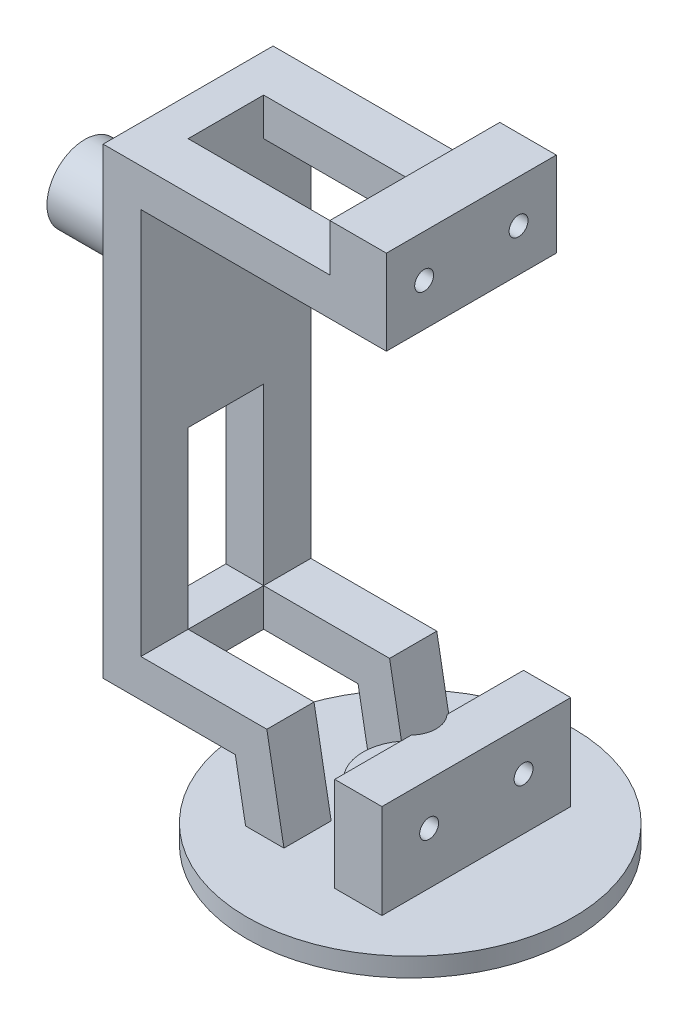
from build123d import *

# Parameters (mm, degrees)
SKETCH1_W                  = 40
SKETCH1_H                  = 25
BOSS_EXTRUDE1_DEPTH        = 2
SKETCH2_W                  = 5
SKETCH2_H                  = 20
BOSS_EXTRUDE2_DEPTH        = 10
SKETCH4_W                  = 19.965035534
SKETCH4_H                  = 6
BOSS_EXTRUDE3_DEPTH        = 5
SKETCH5_R                  = 1
CUT_EXTRUDE2_DEPTH         = 5
SKETCH6_W                  = 4
SKETCH6_H                  = 5
BOSS_EXTRUDE4_DEPTH        = 10
SKETCH8_W                  = 5
SKETCH8_H                  = 4
BOSS_EXTRUDE5_DEPTH        = 10
SKETCH9_W                  = 4
SKETCH9_H                  = 5
BOSS_EXTRUDE6_DEPTH        = 45
SKETCH12_W                 = 18
SKETCH12_H                 = 4
BOSS_EXTRUDE8_DEPTH        = 4
SKETCH13_W                 = 5
SKETCH13_H                 = 4
BOSS_EXTRUDE9_DEPTH        = 26
SKETCH14_W                 = 18
SKETCH14_H                 = 4
BOSS_EXTRUDE10_DEPTH       = 6
SKETCH16_W                 = 5.988277512
SKETCH16_H                 = 18
BOSS_EXTRUDE11_DEPTH       = 5
SKETCH15_R                 = 1
CUT_EXTRUDE3_DEPTH         = 6
SKETCH17_R                 = 3
CUT_EXTRUDE5_DEPTH         = 6
SKETCH24_W                 = 8
SKETCH24_H                 = 18.5
BOSS_EXTRUDE18_DEPTH       = 4
BOSS_EXTRUDE20_START       = -1
SKETCH20_R                 = 5
SKETCH20_R_2               = 3
BOSS_EXTRUDE20_DEPTH       = 1
BOSS_EXTRUDE21_OUTLINE_R   = 2.998308623
BOSS_EXTRUDE21_OUTLINE_R_2 = 1.5
BOSS_EXTRUDE21_DEPTH       = 1
SKETCH27_R                 = 5
SKETCH27_R_2               = 2.75
BOSS_EXTRUDE22_DEPTH       = 2
SKETCH28_R                 = 2.75
CUT_EXTRUDE10_DEPTH        = 10
SKETCH31_R                 = 4
BOSS_EXTRUDE23_DEPTH       = 11
SKETCH32_R                 = 23.58495283
BOSS_EXTRUDE24_DEPTH       = 2
SKETCH33_R                 = 3
CUT_EXTRUDE11_DEPTH        = 3
CUT_EXTRUDE12_DEPTH        = 10
CUT_EXTRUDE13_DEPTH        = 4
BOSS_EXTRUDE25_DEPTH       = 2
CUT_EXTRUDE15_DEPTH        = 2
SKETCH38_W                 = 4
SKETCH38_H                 = 6
CUT_EXTRUDE16_DEPTH        = 76.679363321
BOSS_EXTRUDE26_DEPTH       = 5


# Read off the part's stored shape, not the designer's step: Boss-Extrude21
with BuildPart() as part:
    # Sketch1 → Boss-Extrude1 (new body)
    with BuildSketch(Plane(origin=(0, 0, 0), x_dir=(1, 0, 0), z_dir=(0, 1, 0))):
        Rectangle(SKETCH1_W, SKETCH1_H)
    extrude(amount=BOSS_EXTRUDE1_DEPTH)

    # Sketch2 → Boss-Extrude2 (add)
    with BuildSketch(Plane(origin=(0, 2, 0), x_dir=(1, 0, 0), z_dir=(0, 1, 0))):
        with Locations((4.5, 0)):
            Rectangle(SKETCH2_W, SKETCH2_H)
    extrude(amount=BOSS_EXTRUDE2_DEPTH)

    # Sketch4 → Boss-Extrude3 (add)
    with BuildSketch(Plane(origin=(7, 0, 0), x_dir=(0, 0, -1), z_dir=(1, 0, 0))):
        with Locations((-0.017482233, 9)):
            Rectangle(SKETCH4_W, SKETCH4_H)
    extrude(amount=-BOSS_EXTRUDE3_DEPTH)

    # Sketch5 → Cut-Extrude2 (cut)
    with BuildSketch(Plane(origin=(7, 0, 0), x_dir=(0, 0, -1), z_dir=(1, 0, 0))):
        with Locations((5, 7.5)):
            Circle(SKETCH5_R)
        with Locations((-5, 7.5)):
            Circle(SKETCH5_R)
    extrude(amount=-CUT_EXTRUDE2_DEPTH, mode=Mode.SUBTRACT)

    # Sketch6 → Boss-Extrude4 (add)
    with BuildSketch(Plane(origin=(0, 2, 0), x_dir=(1, 0, 0), z_dir=(0, 1, 0))):
        with Locations((-11.527661753, -6.5)):
            Rectangle(SKETCH6_W, SKETCH6_H)
        with Locations((-11.527661753, 6.5)):
            Rectangle(SKETCH6_W, SKETCH6_H)
    extrude(amount=BOSS_EXTRUDE4_DEPTH)

    # Sketch8 → Boss-Extrude5 (add)
    with BuildSketch(Plane.ZY.offset(13.527661753)):
        with Locations((-6.5, 10)):
            Rectangle(SKETCH8_W, SKETCH8_H)
    boss_extrude5 = extrude(amount=BOSS_EXTRUDE5_DEPTH)

    # Mirror1: Boss-Extrude5 across plane
    add(boss_extrude5.mirror(Plane(origin=(0, 0, 0), x_dir=(1, 0, 0), z_dir=(0, 0, -1))))

    # Sketch9 → Boss-Extrude6 (add)
    with BuildSketch(Plane(origin=(0, 12, 0), x_dir=(1, 0, 0), z_dir=(0, 1, 0))):
        with Locations((-21.527661753, 6.5)):
            Rectangle(SKETCH9_W, SKETCH9_H)
    boss_extrude6 = extrude(amount=BOSS_EXTRUDE6_DEPTH)

    # Mirror2: Boss-Extrude5 across plane
    add(boss_extrude5.mirror(Plane(origin=(0, 0, 0), x_dir=(1, 0, 0), z_dir=(0, 0, -1))))

    # Mirror3: Boss-Extrude6 across plane
    add(boss_extrude6.mirror(Plane(origin=(0, 0, 0), x_dir=(1, 0, 0), z_dir=(0, 0, -1))))

    # Sketch12 → Boss-Extrude8 (add)
    with BuildSketch(Plane.ZY.offset(23.527661753)):
        with Locations((0, 55)):
            Rectangle(SKETCH12_W, SKETCH12_H)
        with Locations((0, 10)):
            Rectangle(SKETCH12_W, SKETCH12_H)
        with Locations((0, 32.5)):
            Rectangle(SKETCH12_W, SKETCH12_H)
    extrude(amount=-BOSS_EXTRUDE8_DEPTH)

    # Sketch13 → Boss-Extrude9 (add)
    with BuildSketch(Plane(origin=(-19.527661753, 0, 0), x_dir=(0, 0, -1), z_dir=(1, 0, 0))):
        with Locations((-6.5, 55)):
            Rectangle(SKETCH13_W, SKETCH13_H)
        with Locations((6.5, 55)):
            Rectangle(SKETCH13_W, SKETCH13_H)
    extrude(amount=BOSS_EXTRUDE9_DEPTH)

    # Sketch14 → Boss-Extrude10 (add)
    with BuildSketch(Plane(origin=(6.472338247, 0, 0), x_dir=(0, 0, -1), z_dir=(1, 0, 0))):
        with Locations((0, 55)):
            Rectangle(SKETCH14_W, SKETCH14_H)
    extrude(amount=-BOSS_EXTRUDE10_DEPTH)

    # Sketch16 → Boss-Extrude11 (add)
    with BuildSketch(Plane(origin=(0, 57, 0), x_dir=(1, 0, 0), z_dir=(0, 1, 0))):
        with Locations((3.478199491, 0)):
            Rectangle(SKETCH16_W, SKETCH16_H)
    extrude(amount=BOSS_EXTRUDE11_DEPTH)

    # Sketch15 → Cut-Extrude3 (cut)
    with BuildSketch(Plane(origin=(6.472338247, 0, 0), x_dir=(0, 0, -1), z_dir=(1, 0, 0))):
        with Locations((-5, 57.5)):
            Circle(SKETCH15_R)
        with Locations((5, 57.5)):
            Circle(SKETCH15_R)
    extrude(amount=-CUT_EXTRUDE3_DEPTH, mode=Mode.SUBTRACT)

    # Sketch17 → Cut-Extrude5 (cut)
    with BuildSketch(Plane.XZ):
        with Locations(Location((0, 0, 0), (0, 0, 270))):
            Circle(SKETCH17_R)
    extrude(amount=-CUT_EXTRUDE5_DEPTH, mode=Mode.SUBTRACT)

    # Sketch24 → Boss-Extrude18 (add)
    with BuildSketch(Plane.ZY.offset(23.527661753)):
        with Locations((0, 43.75)):
            Rectangle(SKETCH24_W, SKETCH24_H)
    extrude(amount=-BOSS_EXTRUDE18_DEPTH)

    # Sketch20 → Boss-Extrude20 (add)
    with BuildSketch(Plane(origin=(0, 3, 0), x_dir=(1, 0, 0), z_dir=(0, 1, 0)).offset(BOSS_EXTRUDE20_START)):
        Circle(SKETCH20_R)
        with Locations(Location((0, 0, 0), (0, 0, 90))):
            Circle(SKETCH20_R_2, mode=Mode.SUBTRACT)
    extrude(amount=BOSS_EXTRUDE20_DEPTH)

    # Boss-Extrude21 outline → Boss-Extrude21 (add)
    # profile 1 of 2: a face of its own
    with BuildSketch(Plane(origin=(0, 3, 0), x_dir=(1, 0, 0), z_dir=(0, 1, 0))):
        with BuildLine():
            ThreePointArc((2, -2.236067977), (-3, 0), (2, 2.236067977))
            Line((2, 2.236067977), (2, 4.582575695))
            ThreePointArc((2, 4.582575695), (-5, 0), (2, -4.582575695))
            Line((2, -4.582575695), (2, -2.236067977))
        make_face()
    # profile 2 of 2: a face of its own
    with BuildSketch(Plane(origin=(0, 3, 0), x_dir=(1, 0, 0), z_dir=(0, 1, 0))):
        Circle(BOSS_EXTRUDE21_OUTLINE_R)
        Circle(BOSS_EXTRUDE21_OUTLINE_R_2, mode=Mode.SUBTRACT)
    extrude(amount=BOSS_EXTRUDE21_DEPTH)

    # Sketch27 → Boss-Extrude22 (add)
    with BuildSketch(Plane(origin=(0, 4, 0), x_dir=(1, 0, 0), z_dir=(0, 1, 0))):
        Circle(SKETCH27_R)
        with Locations(Location((0, 0, 0), (0, 0, 43.341758227))):
            Circle(SKETCH27_R_2, mode=Mode.SUBTRACT)
    extrude(amount=BOSS_EXTRUDE22_DEPTH)

    # Sketch28 → Cut-Extrude10 (cut)
    with BuildSketch(Plane(origin=(0, 6, 0), x_dir=(1, 0, 0), z_dir=(0, 1, 0))):
        with Locations(Location((0, 0, 0), (0, 0, 43.341758227))):
            Circle(SKETCH28_R)
    extrude(amount=CUT_EXTRUDE10_DEPTH, mode=Mode.SUBTRACT)

    # Sketch31 → Boss-Extrude23 (add)
    with BuildSketch(Plane.ZY.offset(23.527661753)):
        with Locations((-0.05, 43.4)):
            Circle(SKETCH31_R)
    extrude(amount=BOSS_EXTRUDE23_DEPTH)

    # Sketch32 → Boss-Extrude24 (add)
    with BuildSketch(Plane.XZ):
        with Locations(Location((0, 0, 0), (0, 0, 270))):
            Circle(SKETCH32_R)
    extrude(amount=-BOSS_EXTRUDE24_DEPTH)

    # Sketch33 → Cut-Extrude11 (cut)
    with BuildSketch(Plane.XZ):
        with Locations(Location((0, 0, 0), (0, 0, 270))):
            Circle(SKETCH33_R)
    extrude(amount=-CUT_EXTRUDE11_DEPTH, mode=Mode.SUBTRACT)

    # Sketch34 → Cut-Extrude12 (cut)
    with BuildSketch(Plane(origin=(0, 2, 0), x_dir=(1, 0, 0), z_dir=(0, 1, 0))):
        with BuildLine():
            Line((-10.212765957, 21.718642027), (-10.212765957, 13.952471709))
            Line((-10.212765957, 13.952471709), (10.212765957, 13.952471709))
            Line((10.212765957, 13.952471709), (10.212765957, 21.718642027))
            ThreePointArc((10.212765957, 21.718642027), (0, 24), (-10.212765957, 21.718642027))
        make_face()
    extrude(amount=-CUT_EXTRUDE12_DEPTH, mode=Mode.SUBTRACT)

    # Sketch35 → Cut-Extrude13 (cut)
    with BuildSketch(Plane.XZ):
        with BuildLine():
            Line((-17.290808405, 0), (-23.58495283, 0))
            ThreePointArc((-23.58495283, 0), (-19.96393753, -12.557515611), (-10.212765957, -21.259101851))
            Line((-10.212765957, -21.259101851), (-10.212765957, -13.952471709))
            ThreePointArc((-10.212765957, -13.952471709), (-15.420101082, -7.822565942), (-17.290808405, 0))
        make_face()
    extrude(amount=-CUT_EXTRUDE13_DEPTH, mode=Mode.SUBTRACT)

    # Sketch36 → Boss-Extrude25 (add)
    with BuildSketch(Plane.XZ):
        with BuildLine():
            Line((-10.212765957, -13.952471709), (10.212765957, -13.952471709))
            ThreePointArc((10.212765957, -13.952471709), (0, -17.290808405), (-10.212765957, -13.952471709))
        make_face()
    extrude(amount=-BOSS_EXTRUDE25_DEPTH)

    # Sketch37 → Cut-Extrude15 (cut)
    with BuildSketch(Plane.XZ):
        with BuildLine():
            Line((-23.58495283, 0), (-17.290808405, 0))
            ThreePointArc((-17.290808405, 0), (7.822565942, 15.420101082), (10.212765957, -13.952471709))
            Line((10.212765957, -13.952471709), (10.212765957, -21.259101851))
            ThreePointArc((10.212765957, -21.259101851), (12.557515611, 19.96393753), (-23.58495283, 0))
        make_face()
    extrude(amount=-CUT_EXTRUDE15_DEPTH, mode=Mode.SUBTRACT)

    # Sketch38 → Cut-Extrude16 (cut, through all)
    with BuildSketch(Plane.XY.offset(9)):
        with Locations((-11.527661753, 5)):
            Rectangle(SKETCH38_W, SKETCH38_H)
    extrude(amount=-CUT_EXTRUDE16_DEPTH, mode=Mode.SUBTRACT)


with BuildPart() as cut_extrude16_piece_1:
    # of the separate pieces the step leaves, piece 1, a body of its own (cut_extrude16_pieces)
    add(part.part.solids().sort_by_distance((-9.527661753, 8, -4))[0])



with BuildPart() as cut_extrude16_piece_2:
    # of the separate pieces the step leaves, piece 2, a body of its own (cut_extrude16_pieces)
    add(part.part.solids().sort_by_distance((-17.290808405, 0, 0))[0])


with BuildPart() as cut_extrude16_piece_1_1:
    add(cut_extrude16_piece_1.part)

    add(cut_extrude16_piece_2.part)  # Boss-Extrude26 merges Cut-Extrude16 piece 2
    # Sketch39 → Boss-Extrude26 (add)
    with BuildSketch(Plane.XY.offset(9)):
        Polygon((-9.527661753, 8), (-8.439950649, 2), (-4.374753349, 2), (-6.187605188, 12), (-9.527661753, 12), align=None)
    boss_extrude26 = extrude(amount=-BOSS_EXTRUDE26_DEPTH)

    # Mirror4: Boss-Extrude26 across plane
    add(boss_extrude26.mirror(Plane(origin=(0, 0, 0), x_dir=(1, 0, 0), z_dir=(0, 0, -1))))


solid = cut_extrude16_piece_1_1.part
